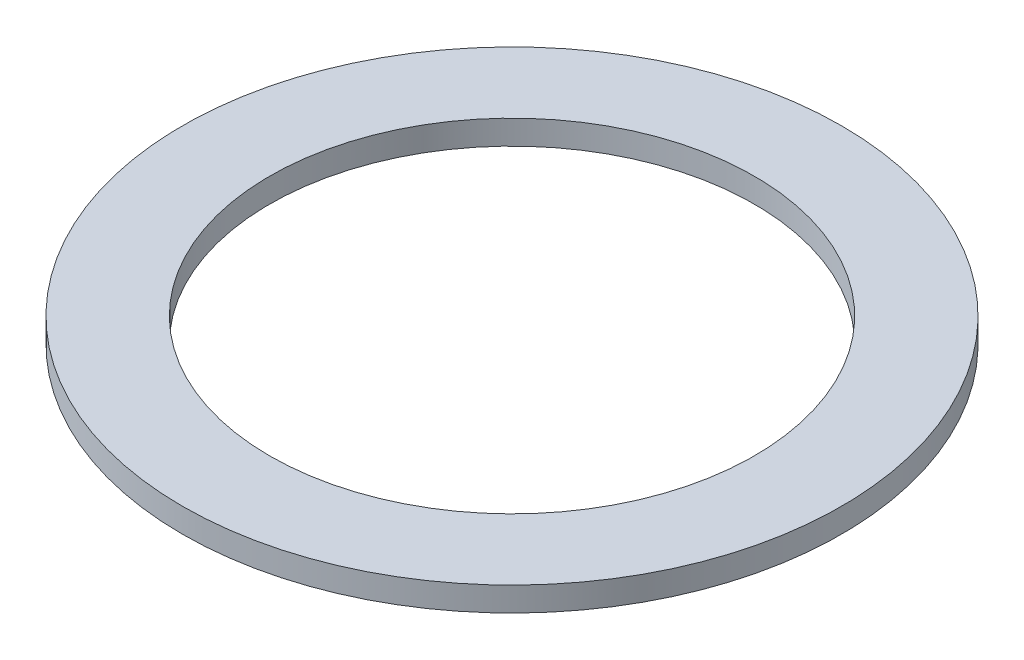
from build123d import *

# Parameters (mm, degrees)
SKETCH1_R           = 17.272
SKETCH1_R_2         = 12.7
BOSS_EXTRUDE1_DEPTH = 0.635


with BuildPart() as part:
    # Sketch1 → Boss-Extrude1 (new, symmetric)
    with BuildSketch(Plane(origin=(0, 0, 0), x_dir=(1, 0, 0), z_dir=(0, 1, 0))):
        Circle(SKETCH1_R)
        Circle(SKETCH1_R_2, mode=Mode.SUBTRACT)
    extrude(amount=BOSS_EXTRUDE1_DEPTH, both=True)


solid = part.part
